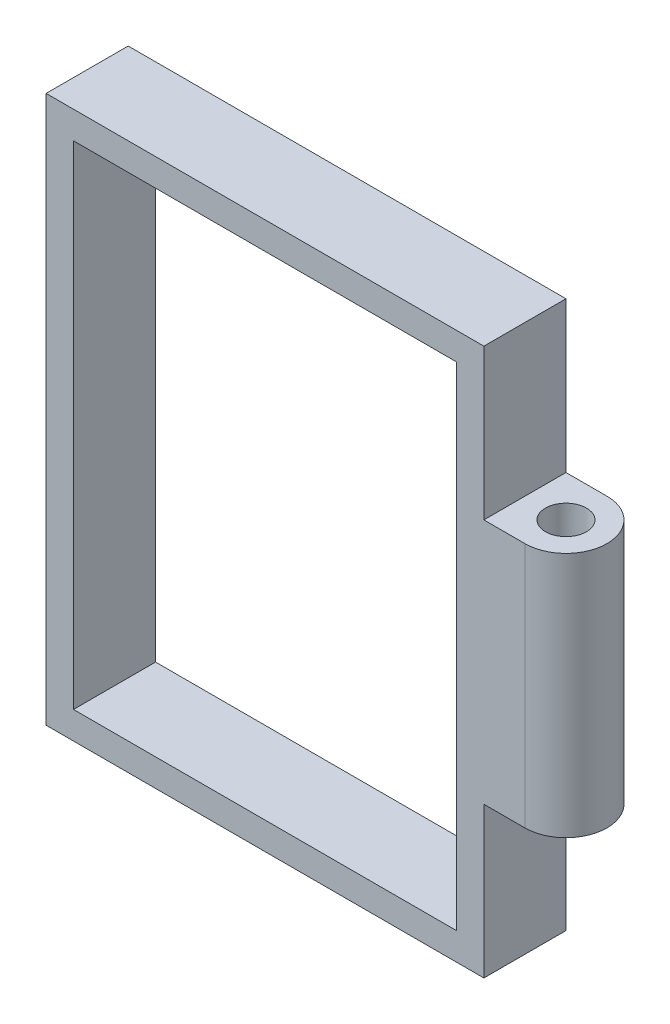
from build123d import *

# Parameters (mm, degrees)
CROQUIS1_W                   = 16
CROQUIS1_H                   = 3
SALIENTE_EXTRUIR1_DEPTH      = 20
SALIENTE_EXTRUIR2_DEPTH      = 4.5
SALIENTE_EXTRUIR2_DEPTH_BACK = 4.5
CROQUIS3_R                   = 0.75
CORTAR_EXTRUIR2_REACH        = 25.022
CROQUIS5_W                   = 14
CROQUIS5_H                   = 18


with BuildPart() as part:
    # Croquis1 → Saliente-Extruir1 (new body)
    with BuildSketch(Plane(origin=(0, 0, 0), x_dir=(1, 0, 0), z_dir=(0, 1, 0))):
        Rectangle(CROQUIS1_W, CROQUIS1_H)
    extrude(amount=SALIENTE_EXTRUIR1_DEPTH)

    # Croquis3 → Saliente-Extruir2 (add, two sides: drawn at the far end of the back side and taken through both)
    with BuildSketch(Plane(origin=(0, 10, 0), x_dir=(1, 0, 0), z_dir=(0, 1, 0)).offset(-SALIENTE_EXTRUIR2_DEPTH_BACK)):
        with BuildLine():
            Line((8, 1.5), (8, -1.5))
            Line((8, -1.5), (9.5, -1.5))
            ThreePointArc((9.5, -1.5), (11, 0), (9.5, 1.5))
            Line((9.5, 1.5), (8, 1.5))
        make_face()
        with Locations((9.5, 0)):
            Circle(CROQUIS3_R, mode=Mode.SUBTRACT)
    extrude(amount=SALIENTE_EXTRUIR2_DEPTH + SALIENTE_EXTRUIR2_DEPTH_BACK)

    # Croquis5 → Cortar-Extruir2 (cut, up to next)
    with BuildSketch(Plane.XY.offset(1.5), mode=Mode.PRIVATE) as cortar_extruir2_sk1:
        with Locations((0, 10)):
            Rectangle(CROQUIS5_W, CROQUIS5_H)
    cortar_extruir2_tool1 = extrude(cortar_extruir2_sk1.sketch, amount=-CORTAR_EXTRUIR2_REACH, mode=Mode.PRIVATE) & part.part
    add(cortar_extruir2_tool1.solids().sort_by_distance((0, 10, 1.5))[0], mode=Mode.SUBTRACT)


solid = part.part
